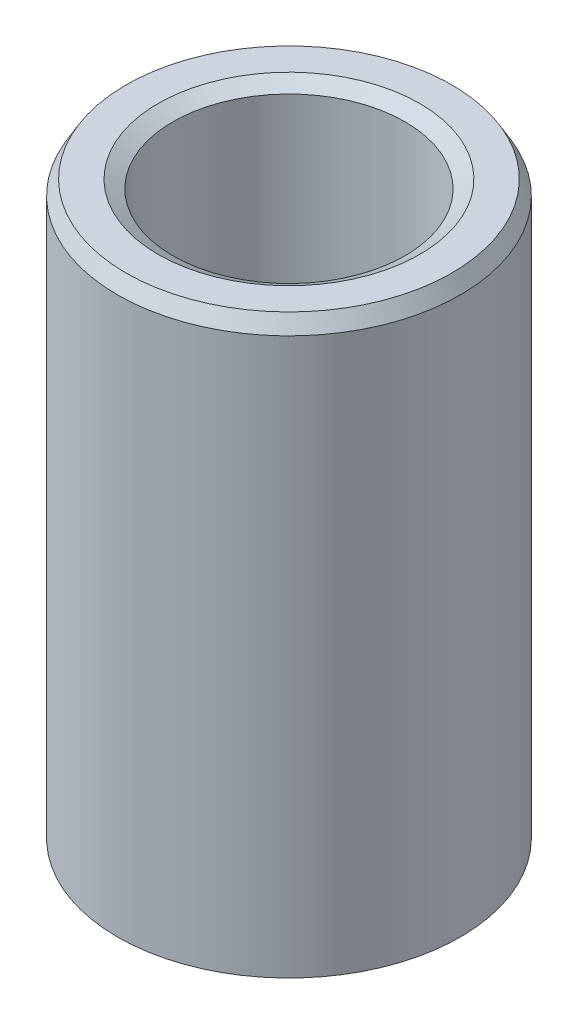
from build123d import *
from OCP.BRepFilletAPI import BRepFilletAPI_MakeChamfer

# Parameters (mm, degrees)
SKETCH1_R           = 17.5
BOSS_EXTRUDE1_DEPTH = 59.145733291
SKETCH2_R           = 11.851063439
CUT_EXTRUDE1_DEPTH  = 65.114879447
CHAMFER1_SIZE       = 1.501844989
CHAMFER1_SIZE2      = 0.867090609


with BuildPart() as part:
    # Sketch1 → Boss-Extrude1 (new body)
    with BuildSketch(Plane(origin=(0, 0, 0), x_dir=(1, 0, 0), z_dir=(0, 1, 0))):
        Circle(SKETCH1_R)
    extrude(amount=BOSS_EXTRUDE1_DEPTH)

    # Sketch2 → Cut-Extrude1 (cut, through all)
    with BuildSketch(Plane(origin=(0, 0, 0), x_dir=(1, 0, 0), z_dir=(0, 1, 0))):
        Circle(SKETCH2_R)
    extrude(amount=CUT_EXTRUDE1_DEPTH, mode=Mode.SUBTRACT)

    # Chamfer1: one chamfer whose edges measure the first distance from different faces: ONE call of the kernel's chamfer builder (chamfer() names one face for all edges)
    chamfer1_edges_1 = [part.edges().sort_by_distance(p)[0] for p in [
        (-11.851063439, 59.145733291, 0),
    ]]
    chamfer1_side_1 = [part.faces().sort_by_distance(p)[0] for p in [
        (-17.005025253, 59.145733291, 0),
    ]]
    chamfer1_edges_2 = [part.edges().sort_by_distance(p)[0] for p in [
        (-11.851063439, 0, 0),
    ]]
    chamfer1_side_2 = [part.faces().sort_by_distance(p)[0] for p in [
        (-11.851063439, 29.572866645, 0),
    ]]
    chamfer1_edges_3 = [part.edges().sort_by_distance(p)[0] for p in [
        (-17.5, 0, 0),
    ]]
    chamfer1_side_3 = [part.faces().sort_by_distance(p)[0] for p in [
        (-17.005025253, 0, 0),
    ]]
    chamfer1_edges_4 = [part.edges().sort_by_distance(p)[0] for p in [
        (-17.5, 59.145733291, 0),
    ]]
    chamfer1_side_4 = [part.faces().sort_by_distance(p)[0] for p in [
        (-17.5, 29.572866645, 0),
    ]]
    chamfer1 = BRepFilletAPI_MakeChamfer(part.part.solid().wrapped)
    for e in chamfer1_edges_1:
        chamfer1.Add(CHAMFER1_SIZE, CHAMFER1_SIZE2, e.wrapped, chamfer1_side_1[0].wrapped)  # the first distance lies on this face
    for e in chamfer1_edges_2:
        chamfer1.Add(CHAMFER1_SIZE, CHAMFER1_SIZE2, e.wrapped, chamfer1_side_2[0].wrapped)  # the first distance lies on this face
    for e in chamfer1_edges_3:
        chamfer1.Add(CHAMFER1_SIZE, CHAMFER1_SIZE2, e.wrapped, chamfer1_side_3[0].wrapped)  # the first distance lies on this face
    for e in chamfer1_edges_4:
        chamfer1.Add(CHAMFER1_SIZE, CHAMFER1_SIZE2, e.wrapped, chamfer1_side_4[0].wrapped)  # the first distance lies on this face
    add(Compound.cast(chamfer1.Shape()), mode=Mode.REPLACE)


solid = part.part
